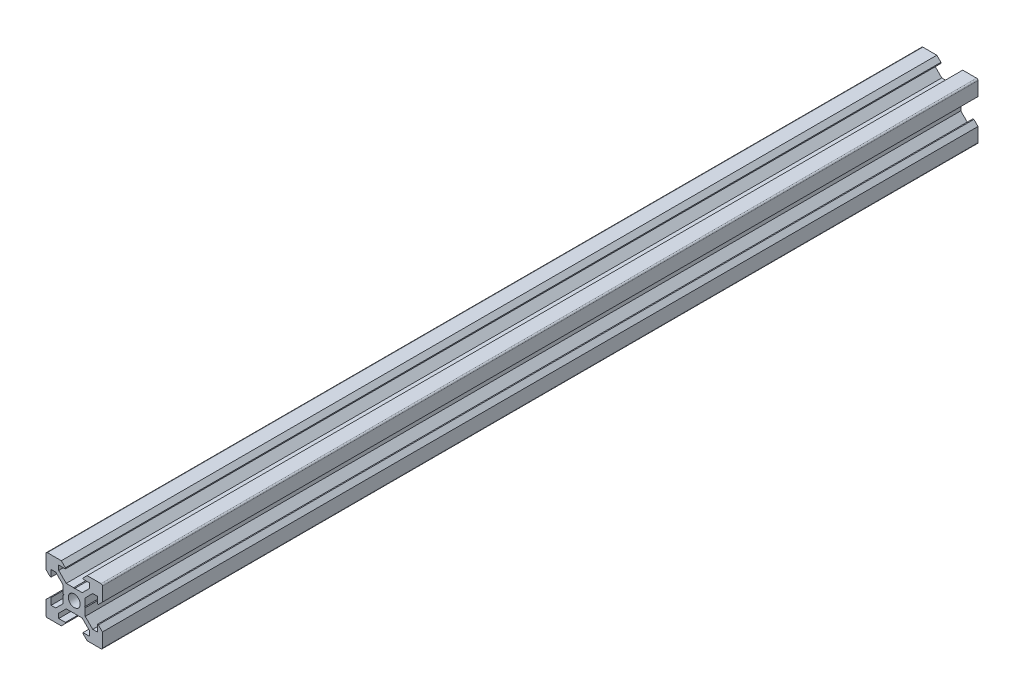
from build123d import *

# Parameters (mm, degrees)
V_SLOT_20X20X500_LINEAR_RAIL_BOSS_2_R        = 2.1
V_SLOT_20X20X500_LINEAR_RAIL_BOSS_EXTR_DEPTH = 500
CUT_EXTRUDE1_DEPTH                           = 501.199960016
CUT_EXTRUDE1_DEPTH_BACK                      = 501.199960016
SKETCH1_OUTSIDE_W                            = 122.16
SKETCH1_OUTSIDE_H                            = 602.16
SKETCH1_OUTSIDE_W_2                          = 105.529320626
SKETCH1_OUTSIDE_H_2                          = 310.200000001


# Read off the part's stored shape, not the designer's step: <V-Slot 20x20x500 Linear Rail>-<Boss-Extrude1>
with BuildPart() as part:
    # V-Slot 20x20x500 Linear Rail_-_Boss- 2 → <V-Slot 20x20x500 Linear Rail>-<Boss-Extrude1> (new body)
    with BuildSketch(Plane.XY):
        with BuildLine():
            Line((3.9, -2.839339828), (3.9, -0.21))
            Line((3.9, -0.21), (3.69, 0))
            Line((3.69, 0), (3.9, 0.21))
            Line((3.9, 0.21), (3.9, 2.839339828))
            Line((3.9, 2.839339828), (6.560660172, 5.5))
            Line((6.560660172, 5.5), (8.2, 5.5))
            Line((8.2, 5.5), (8.2, 3.125))
            Line((8.2, 3.125), (8.545, 3.125))
            Line((8.545, 3.125), (10, 4.58))
            Line((10, 4.58), (10, 9.5))
            ThreePointArc((10, 9.5), (9.853553391, 9.853553391), (9.5, 10))
            Line((9.5, 10), (4.58, 10))
            Line((4.58, 10), (3.125, 8.545))
            Line((3.125, 8.545), (3.125, 8.2))
            Line((3.125, 8.2), (5.5, 8.2))
            Line((5.5, 8.2), (5.5, 6.560660172))
            Line((5.5, 6.560660172), (2.839339828, 3.9))
            Line((2.839339828, 3.9), (0.21, 3.9))
            Line((0.21, 3.9), (0, 3.69))
            Line((0, 3.69), (-0.21, 3.9))
            Line((-0.21, 3.9), (-2.839339828, 3.9))
            Line((-2.839339828, 3.9), (-5.5, 6.560660172))
            Line((-5.5, 6.560660172), (-5.5, 8.2))
            Line((-5.5, 8.2), (-3.125, 8.2))
            Line((-3.125, 8.2), (-3.125, 8.545))
            Line((-3.125, 8.545), (-4.58, 10))
            Line((-4.58, 10), (-9.5, 10))
            ThreePointArc((-9.5, 10), (-9.853553391, 9.853553391), (-10, 9.5))
            Line((-10, 9.5), (-10, 4.58))
            Line((-10, 4.58), (-8.545, 3.125))
            Line((-8.545, 3.125), (-8.2, 3.125))
            Line((-8.2, 3.125), (-8.2, 5.5))
            Line((-8.2, 5.5), (-6.560660172, 5.5))
            Line((-6.560660172, 5.5), (-3.9, 2.839339828))
            Line((-3.9, 2.839339828), (-3.9, 0.21))
            Line((-3.9, 0.21), (-3.69, 0))
            Line((-3.69, 0), (-3.9, -0.21))
            Line((-3.9, -0.21), (-3.9, -2.839339828))
            Line((-3.9, -2.839339828), (-6.560660172, -5.5))
            Line((-6.560660172, -5.5), (-8.2, -5.5))
            Line((-8.2, -5.5), (-8.2, -3.125))
            Line((-8.2, -3.125), (-8.545, -3.125))
            Line((-8.545, -3.125), (-10, -4.58))
            Line((-10, -4.58), (-10, -9.5))
            ThreePointArc((-10, -9.5), (-9.853553391, -9.853553391), (-9.5, -10))
            Line((-9.5, -10), (-4.58, -10))
            Line((-4.58, -10), (-3.125, -8.545))
            Line((-3.125, -8.545), (-3.125, -8.2))
            Line((-3.125, -8.2), (-5.5, -8.2))
            Line((-5.5, -8.2), (-5.5, -6.560660172))
            Line((-5.5, -6.560660172), (-2.839339828, -3.9))
            Line((-2.839339828, -3.9), (-0.21, -3.9))
            Line((-0.21, -3.9), (0, -3.69))
            Line((0, -3.69), (0.21, -3.9))
            Line((0.21, -3.9), (2.839339828, -3.9))
            Line((2.839339828, -3.9), (5.5, -6.560660172))
            Line((5.5, -6.560660172), (5.5, -8.2))
            Line((5.5, -8.2), (3.125, -8.2))
            Line((3.125, -8.2), (3.125, -8.545))
            Line((3.125, -8.545), (4.58, -10))
            Line((4.58, -10), (9.5, -10))
            ThreePointArc((9.5, -10), (9.853553391, -9.853553391), (10, -9.5))
            Line((10, -9.5), (10, -4.58))
            Line((10, -4.58), (8.545, -3.125))
            Line((8.545, -3.125), (8.2, -3.125))
            Line((8.2, -3.125), (8.2, -5.5))
            Line((8.2, -5.5), (6.560660172, -5.5))
            Line((6.560660172, -5.5), (3.9, -2.839339828))
        make_face()
        Circle(V_SLOT_20X20X500_LINEAR_RAIL_BOSS_2_R, mode=Mode.SUBTRACT)
    extrude(amount=V_SLOT_20X20X500_LINEAR_RAIL_BOSS_EXTR_DEPTH)

    # Sketch1 outside → Cut-Extrude1 (cut, two sides: drawn at the far end of the back side and taken through both)
    with BuildSketch(Plane(origin=(0, 0, 0), x_dir=(1, 0, 0), z_dir=(0, 1, 0)).offset(-CUT_EXTRUDE1_DEPTH_BACK)):
        with Locations((0, -250)):
            Rectangle(SKETCH1_OUTSIDE_W, SKETCH1_OUTSIDE_H)
        with Locations((0, -155.100000001)):
            Rectangle(SKETCH1_OUTSIDE_W_2, SKETCH1_OUTSIDE_H_2, mode=Mode.SUBTRACT)
    extrude(amount=CUT_EXTRUDE1_DEPTH + CUT_EXTRUDE1_DEPTH_BACK, mode=Mode.SUBTRACT)


solid = part.part
